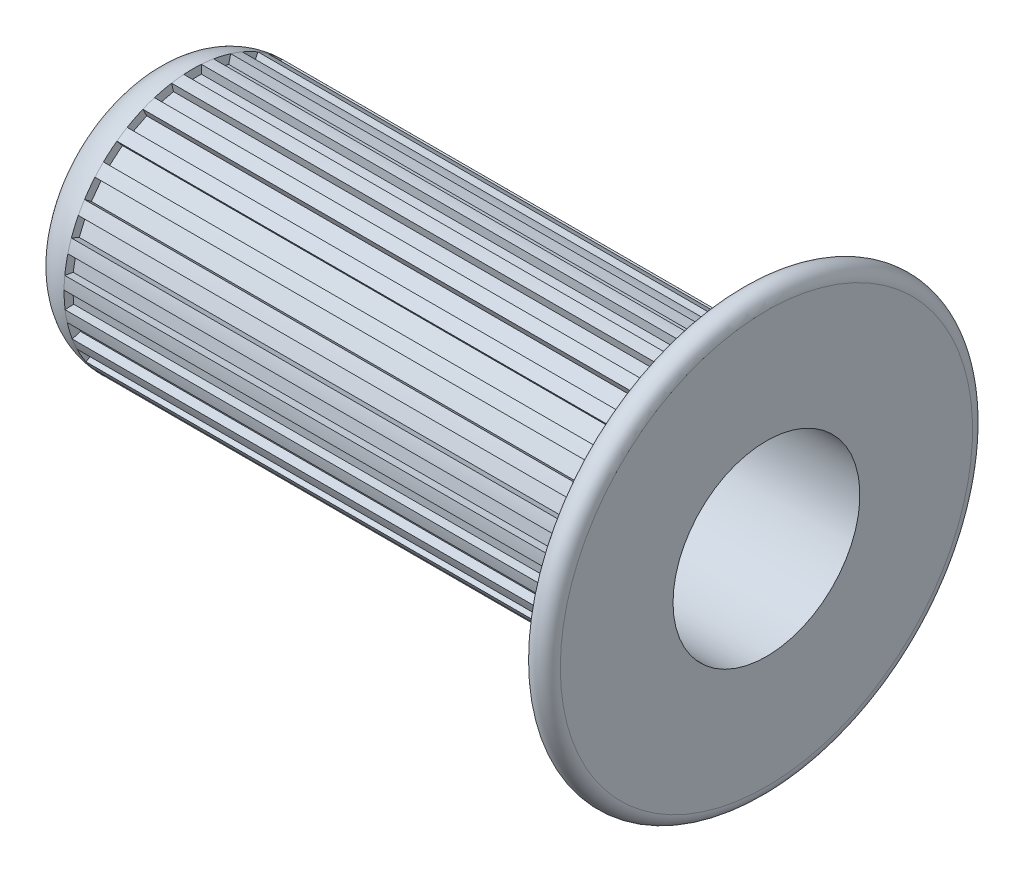
from build123d import *

# Parameters (mm, degrees)
FILLET1_R          = 1.5
SKETCH3_W          = 2
SKETCH3_H          = 2
CUT_EXTRUDE1_DEPTH = 62.42


with BuildPart() as part:
    # Sketch2 → Revolve1 (revolve)
    with BuildSketch(Plane.XY, mode=Mode.PRIVATE) as revolve1_sk:
        with BuildLine():
            Line((0, 25), (0, 10.65))
            Line((0, 10.65), (-67.42, 10.65))
            Line((-67.42, 10.65), (-67.42, 0))
            Line((-67.42, 0), (-70.42, 0))
            Line((-70.42, 0), (-70.42, 9.65))
            ThreePointArc((-70.42, 9.65), (-68.955533906, 13.185533906), (-65.42, 14.65))
            Line((-65.42, 14.65), (-3, 14.65))
            Line((-3, 14.65), (-3, 25))
            Line((-3, 25), (0, 25))
        make_face()
    revolve(revolve1_sk.sketch.rotate(Axis((-556.896186161, 0, 0), (1, 0, 0)), 90), axis=Axis((-556.896186161, 0, 0), (1, 0, 0)))

    # Fillet1
    fillet1_edges = [part.edges().sort_by_distance(p)[0] for p in [
        (0, 0, -25),
        (-3, 0, -25),
    ]]
    fillet(fillet1_edges, radius=FILLET1_R - 0.0001)  # a hair under: the kernel refuses the full size

    # Sketch3 → Cut-Extrude1 (cut)
    with BuildSketch(Plane.ZY.offset(3)):
        Polygon((2.6341252, 15.450463157), (2.172893459, 13.504373416), (4.1189832, 13.043141675), (4.580214941, 14.989231416), align=None)
        with Locations((0, 14.641465)):
            Rectangle(SKETCH3_W, SKETCH3_H)
        Polygon((6.126244029, 14.426522847), (5.228645668, 12.639257566), (7.015910949, 11.741659206), (7.913509309, 13.528924486), align=None)
        Polygon((9.288095456, 12.624844955), (8.002520237, 11.092756069), (9.534609123, 9.80718085), (10.820184342, 11.339269736), align=None)
        Polygon((11.949223253, 10.142558404), (10.344976868, 8.948241221), (11.539294051, 7.343994835), (13.143540437, 8.538312019), align=None)
        Polygon((13.966165332, 7.113483905), (12.129733118, 6.321324373), (12.92189265, 4.484892159), (14.758324864, 5.277051691), align=None)
        Polygon((15.230187823, 3.700919646), (13.260572317, 3.353623291), (13.607868672, 1.384007785), (15.577484178, 1.73130414), align=None)
        Polygon((15.673146946, 0.088837852), (13.676530629, 0.20512751), (13.560240971, -1.791488807), (15.556857288, -1.907778465), align=None)
        Polygon((15.27116266, -3.528033214), (13.355183635, -2.954426749), (12.78157717, -4.870405773), (14.697556195, -5.444012239), align=None)
        Polygon((14.045906042, -6.954707096), (12.313855235, -5.954707096), (11.313855235, -7.686757904), (13.045906042, -8.686757904), align=None)
        Polygon((12.063430994, -10.006450919), (10.608683711, -8.633967643), (9.236200436, -10.088714926), (10.690947719, -11.461198202), align=None)
        Polygon((9.430613259, -12.518744382), (8.331595303, -10.847768759), (6.66061968, -11.946786715), (7.759637636, -13.617762338), align=None)
        Polygon((6.289388722, -14.356149095), (5.605348435, -12.476763854), (3.725963194, -13.160804141), (4.41000348, -15.040189382), align=None)
        Polygon((2.809101611, -15.419610095), (2.576915783, -13.43313338), (0.590439067, -13.665319208), (0.822624895, -15.651795923), align=None)
        Polygon((-0.822624895, -15.651795923), (-0.590439067, -13.665319208), (-2.576915783, -13.43313338), (-2.809101611, -15.419610095), align=None)
        Polygon((-4.41000348, -15.040189382), (-3.725963194, -13.160804141), (-5.605348435, -12.476763854), (-6.289388722, -14.356149095), align=None)
        Polygon((-7.759637636, -13.617762338), (-6.66061968, -11.946786715), (-8.331595303, -10.847768759), (-9.430613259, -12.518744382), align=None)
        Polygon((-10.690947719, -11.461198202), (-9.236200436, -10.088714926), (-10.608683711, -8.633967643), (-12.063430994, -10.006450919), align=None)
        Polygon((-13.045906042, -8.686757904), (-11.313855235, -7.686757904), (-12.313855235, -5.954707096), (-14.045906042, -6.954707096), align=None)
        Polygon((-14.697556195, -5.444012239), (-12.78157717, -4.870405773), (-13.355183635, -2.954426749), (-15.27116266, -3.528033214), align=None)
        Polygon((-15.556857288, -1.907778465), (-13.560240971, -1.791488807), (-13.676530629, 0.20512751), (-15.673146946, 0.088837852), align=None)
        Polygon((-15.577484178, 1.73130414), (-13.607868672, 1.384007785), (-13.260572317, 3.353623291), (-15.230187823, 3.700919646), align=None)
        Polygon((-14.758324864, 5.277051691), (-12.92189265, 4.484892159), (-12.129733118, 6.321324373), (-13.966165332, 7.113483905), align=None)
        Polygon((-13.143540437, 8.538312019), (-11.539294051, 7.343994835), (-10.344976868, 8.948241221), (-11.949223253, 10.142558404), align=None)
        Polygon((-10.820184342, 11.339269736), (-9.534609123, 9.80718085), (-8.002520237, 11.092756069), (-9.288095456, 12.624844955), align=None)
        Polygon((-7.913509309, 13.528924486), (-7.015910949, 11.741659206), (-5.228645668, 12.639257566), (-6.126244029, 14.426522847), align=None)
        Polygon((-4.580214941, 14.989231416), (-4.1189832, 13.043141675), (-2.172893459, 13.504373416), (-2.6341252, 15.450463157), align=None)
    extrude(amount=CUT_EXTRUDE1_DEPTH, mode=Mode.SUBTRACT)


solid = part.part
